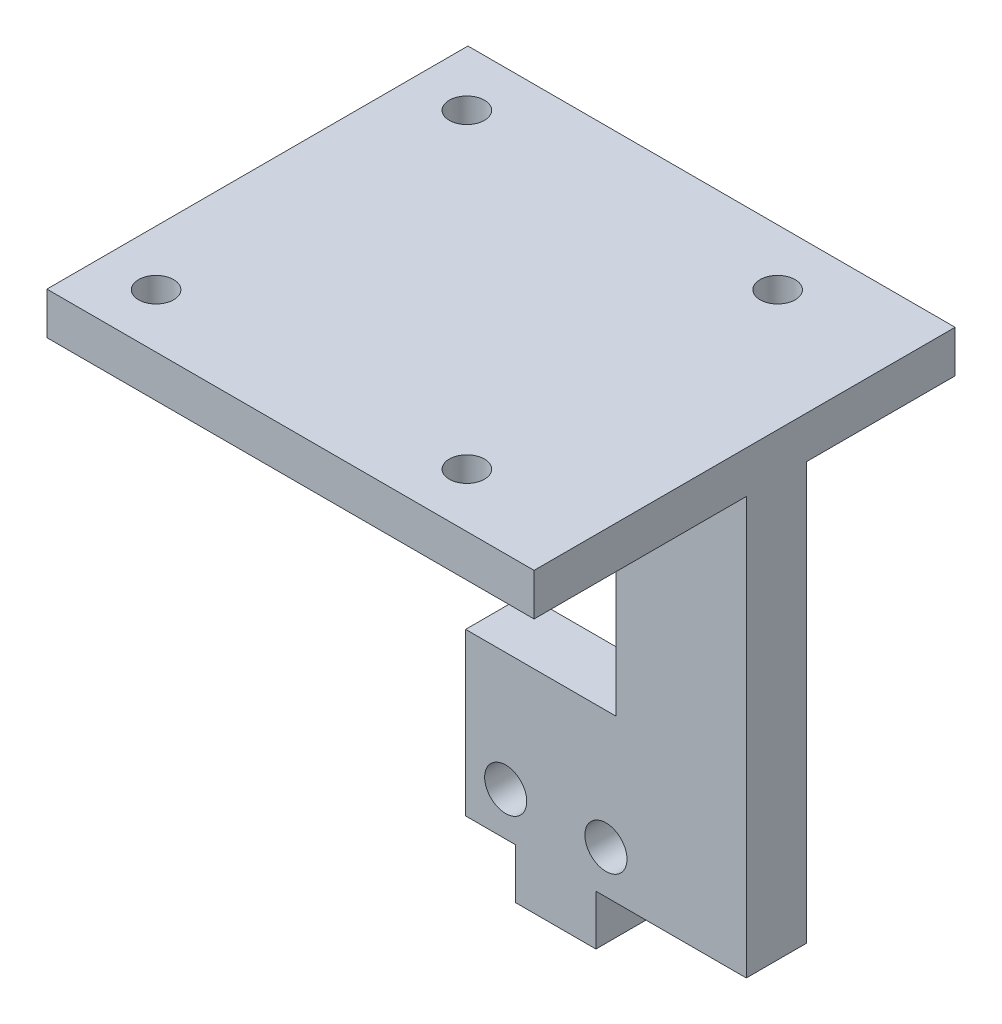
from build123d import *

# Parameters (mm, degrees)
SKETCH_1_W          = 18
SKETCH_1_H          = 50
EXTRUDE_1_DEPTH     = 6
SKETCH_3_R          = 2.1
CUT_EXTRUDE_2_DEPTH = 6
SKETCH_4_W          = 8
SKETCH_4_H          = 10
EXTRUDE_2_DEPTH     = 5
SKETCH_5_W          = 6
SKETCH_5_H          = 50
EXTRUDE_3_DEPTH     = 10
SKETCH_6_W          = 15
SKETCH_6_H          = 33.880633875
CUT_EXTRUDE_3_DEPTH = 10
SKETCH_7_W          = 18.194641251
SKETCH_7_H          = 8.438338953
CUT_EXTRUDE_4_DEPTH = 4.2
SKETCH_8_W          = 58.547266504
SKETCH_8_H          = 42
EXTRUDE_4_DEPTH     = 4.2
SKETCH_9_W          = 49.225807408
SKETCH_9_H          = 6.051517764
CUT_EXTRUDE_5_DEPTH = 9.95
SKETCH_15_R         = 1.75
CUT_EXTRUDE_6_DEPTH = 9.95


with BuildPart() as part:
    # 草图1 → 凸台-拉伸1 (new body)
    with BuildSketch(Plane.XY):
        with Locations((9, 25)):
            Rectangle(SKETCH_1_W, SKETCH_1_H)
    extrude(amount=EXTRUDE_1_DEPTH)

    # 草图3 → 切除-拉伸2 (cut)
    with BuildSketch(Plane.XY.offset(6)):
        with Locations((4, 4.30447472)):
            Circle(SKETCH_3_R)
        with Locations((14, 4.30447472)):
            Circle(SKETCH_3_R)
    extrude(amount=-CUT_EXTRUDE_2_DEPTH, mode=Mode.SUBTRACT)

    # 草图4 → 凸台-拉伸2 (add)
    with BuildSketch(Plane.XZ):
        with Locations((9, 1)):
            Rectangle(SKETCH_4_W, SKETCH_4_H)
    extrude(amount=EXTRUDE_2_DEPTH)

    # 草图5 → 凸台-拉伸3 (add)
    with BuildSketch(Plane(origin=(18, 0, 0), x_dir=(0, 0, -1), z_dir=(1, 0, 0))):
        with Locations((-3, 25)):
            Rectangle(SKETCH_5_W, SKETCH_5_H)
    extrude(amount=EXTRUDE_3_DEPTH)

    # 草图6 → 切除-拉伸3 (cut)
    with BuildSketch(Plane.XY.offset(6)):
        with Locations((7.5, 33.059683062)):
            Rectangle(SKETCH_6_W, SKETCH_6_H)
    extrude(amount=-CUT_EXTRUDE_3_DEPTH, mode=Mode.SUBTRACT)

    # 草图7 → 切除-拉伸4 (cut)
    with BuildSketch(Plane(origin=(0, 50, 0), x_dir=(1, 0, 0), z_dir=(0, 1, 0))):
        with Locations((18.902679374, -1.780830523)):
            Rectangle(SKETCH_7_W, SKETCH_7_H)
    extrude(amount=-CUT_EXTRUDE_4_DEPTH, mode=Mode.SUBTRACT)

    # 草图8 → 凸台-拉伸4 (add)
    with BuildSketch(Plane(origin=(0, 45.8, 0), x_dir=(1, 0, 0), z_dir=(0, 1, 0))):
        with Locations((-1.273633252, -6.17)):
            Rectangle(SKETCH_8_W, SKETCH_8_H)
    extrude(amount=-EXTRUDE_4_DEPTH)

    # 草图9 → 切除-拉伸5 (cut)
    with BuildSketch(Plane.ZY.offset(30.547266504)):
        with Locations((2.557096296, 42.774241118)):
            Rectangle(SKETCH_9_W, SKETCH_9_H)
    extrude(amount=-CUT_EXTRUDE_5_DEPTH, mode=Mode.SUBTRACT)

    # 草图15 → 切除-拉伸6 (cut)
    with BuildSketch(Plane.XZ.offset(-41.6)):
        with Locations((15.90237217, -9.22379542)):
            Circle(SKETCH_15_R)
        with Locations((-15.09762783, -9.22379542)):
            Circle(SKETCH_15_R)
        with Locations((15.90237217, 21.77620458)):
            Circle(SKETCH_15_R)
        with Locations((-15.09762783, 21.77620458)):
            Circle(SKETCH_15_R)
    extrude(amount=-CUT_EXTRUDE_6_DEPTH, mode=Mode.SUBTRACT)


solid = part.part
